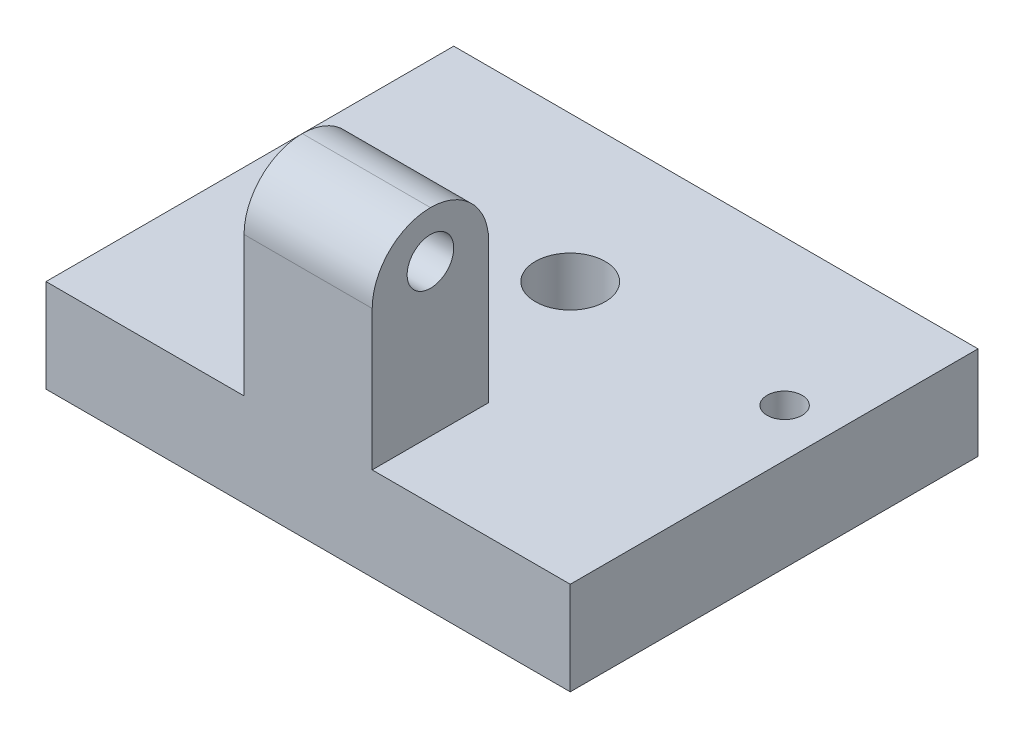
from build123d import *

# Parameters (mm, degrees)
SKETCH2_W           = 45
SKETCH2_H           = 35
SKETCH2_R           = 3
SKETCH2_R_2         = 1.5
BOSS_EXTRUDE1_DEPTH = 5
SKETCH4_R           = 1.5
SKETCH4_R_2         = 3
SKETCH4_W           = 11
SKETCH4_H           = 10
BOSS_EXTRUDE2_DEPTH = 3
SKETCH4_3_W         = 11
SKETCH4_3_H         = 10
BOSS_EXTRUDE3_DEPTH = 20
SKETCH5_R           = 2
CUT_EXTRUDE1_DEPTH  = 20
FILLET1_R           = 5


with BuildPart() as part:
    # Sketch2 → Boss-Extrude1 (new body)
    with BuildSketch(Plane(origin=(0, 0, 0), x_dir=(1, 0, 0), z_dir=(0, 1, 0))):
        Rectangle(SKETCH2_W, SKETCH2_H)
        with Locations(Location((0, 5, 0), (0, 0, 270))):
            Circle(SKETCH2_R, mode=Mode.SUBTRACT)
        with Locations(Location((-18.4, 5, 0), (0, 0, 270))):
            Circle(SKETCH2_R_2, mode=Mode.SUBTRACT)
        with Locations(Location((18.4, 5, 0), (0, 0, 90))):
            Circle(SKETCH2_R_2, mode=Mode.SUBTRACT)
    extrude(amount=BOSS_EXTRUDE1_DEPTH)

    # Sketch4 → Boss-Extrude2 (add)
    # profile 1 of 3: a face of its own
    with BuildSketch(Plane(origin=(0, 5, 0), x_dir=(1, 0, 0), z_dir=(0, 1, 0))):
        Polygon((5.5, -17.5), (15, -17.5), (22.5, -17.5), (22.5, 17.5), (-22.5, 17.5), (-22.5, -17.5), (-15, -17.5), (-5.5, -17.5), (-5.5, -7.5), (5.5, -7.5), align=None)
        with Locations(Location((-18.4, 5, 0), (0, 0, 270))):
            Circle(SKETCH4_R, mode=Mode.SUBTRACT)
        with Locations(Location((0, 5, 0), (0, 0, 270))):
            Circle(SKETCH4_R_2, mode=Mode.SUBTRACT)
        with Locations(Location((18.4, 5, 0), (0, 0, 90))):
            Circle(SKETCH4_R, mode=Mode.SUBTRACT)
    # profile 2 of 3: a face of its own
    with BuildSketch(Plane(origin=(0, 5, 0), x_dir=(1, 0, 0), z_dir=(0, 1, 0))):
        Polygon((5.5, -17.5), (15, -17.5), (22.5, -17.5), (22.5, 17.5), (-22.5, 17.5), (-22.5, -17.5), (-15, -17.5), (-5.5, -17.5), (-5.5, -7.5), (5.5, -7.5), align=None)
        with Locations(Location((-18.4, 5, 0), (0, 0, 270))):
            Circle(SKETCH4_R, mode=Mode.SUBTRACT)
        with Locations(Location((0, 5, 0), (0, 0, 270))):
            Circle(SKETCH4_R_2, mode=Mode.SUBTRACT)
        with Locations(Location((18.4, 5, 0), (0, 0, 90))):
            Circle(SKETCH4_R, mode=Mode.SUBTRACT)
    # profile 3 of 3: a face of its own
    with BuildSketch(Plane(origin=(0, 5, 0), x_dir=(1, 0, 0), z_dir=(0, 1, 0))):
        with Locations((0, -12.5)):
            Rectangle(SKETCH4_W, SKETCH4_H)
    extrude(amount=BOSS_EXTRUDE2_DEPTH)

    # Sketch4<3> → Boss-Extrude3 (add)
    with BuildSketch(Plane(origin=(0, 5, 0), x_dir=(1, 0, 0), z_dir=(0, 1, 0))):
        with Locations((0, -12.5)):
            Rectangle(SKETCH4_3_W, SKETCH4_3_H)
    extrude(amount=BOSS_EXTRUDE3_DEPTH)

    # Sketch5 → Cut-Extrude1 (cut)
    with BuildSketch(Plane(origin=(5.5, 0, 0), x_dir=(0, 0, -1), z_dir=(1, 0, 0))):
        with Locations((-12.5, 21)):
            Circle(SKETCH5_R)
    extrude(amount=-CUT_EXTRUDE1_DEPTH, mode=Mode.SUBTRACT)

    # Fillet1
    fillet1_edges = [part.edges().sort_by_distance(p)[0] for p in [
        (0, 25, 7.5),
        (0, 25, 17.5),
    ]]
    fillet(fillet1_edges, radius=FILLET1_R - 0.0001)  # a hair under: the kernel refuses the full size


solid = part.part
